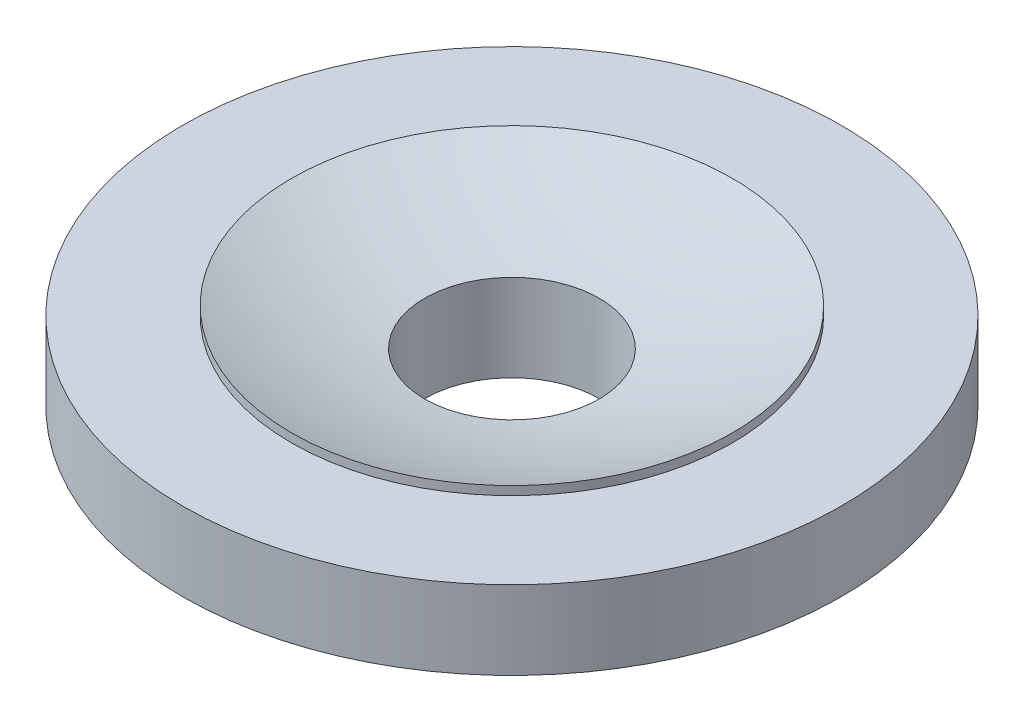
from build123d import *

# Parameters (mm, degrees)
CUT_EXTRUDE3_DEPTH      = 222.815238431
CUT_EXTRUDE3_DEPTH_BACK = 222.815238431
SKETCH9_R               = 40


with BuildPart() as part:
    # Sketch7 → Revolve4 (revolve)
    with BuildSketch(Plane.XY):
        with BuildLine():
            Line((-101, 0), (-101, -4))
            Line((-101, -4), (-151, -4))
            Line((-151, -4), (-151, -39.988196333))
            Line((-151, -39.988196333), (-100.028324094, -39.988196333))
            ThreePointArc((-100.028324094, -39.988196333), (-51.005239699, -54.947966305), (0, -60))
            Line((0, -60), (0, -20))
            ThreePointArc((0, -20), (-51.49990945, -15.049542725), (-101, 0))
        make_face()
    revolve(axis=Axis((0, 0, 0), (0, -1, 0)))

    # Sketch9 → Cut-Extrude3 (cut, two sides: drawn at the far end of the back side and taken through both)
    with BuildSketch(Plane(origin=(0, 0, 0), x_dir=(1, 0, 0), z_dir=(0, 1, 0)).offset(-CUT_EXTRUDE3_DEPTH_BACK)):
        Circle(SKETCH9_R)
    extrude(amount=CUT_EXTRUDE3_DEPTH + CUT_EXTRUDE3_DEPTH_BACK, mode=Mode.SUBTRACT)


solid = part.part
